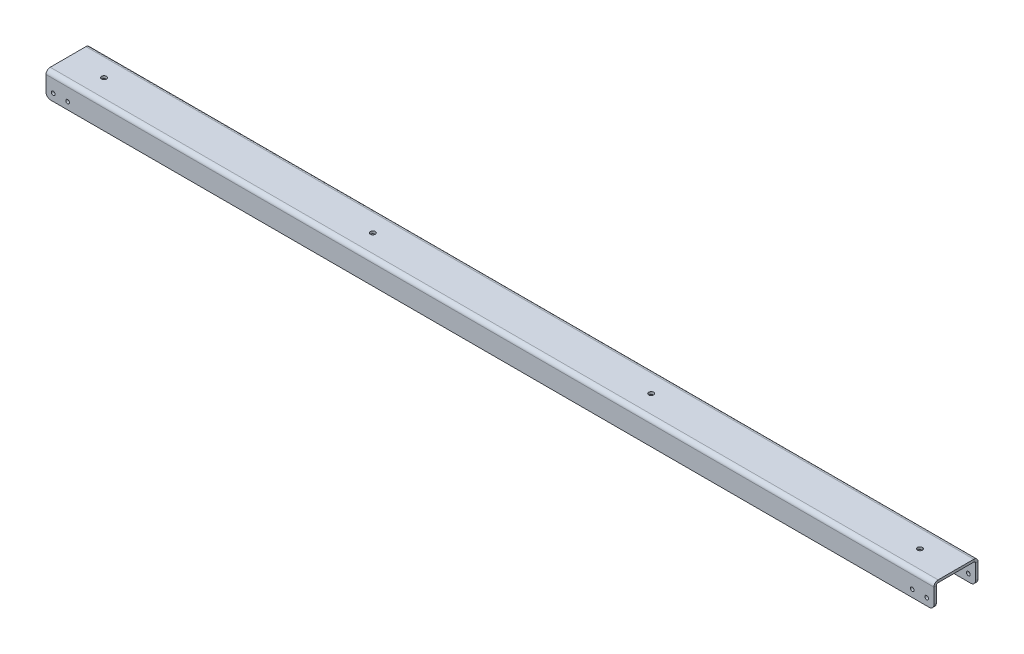
from build123d import *

# Parameters (mm, degrees)
SKETCH1_W                      = 1174.75
SKETCH1_H                      = 51.816
BASE_FLANGE1_DEPTH             = 3.2639
EDGE_FLANGE1_STRIP_W           = 17.6276
EDGE_FLANGE1_STRIP_H           = 3.2639
EDGE_FLANGE1_STRIP_CUT_DEPTH   = 1174.75
EDGE_FLANGE1_STRIP_2_W         = 17.6276
EDGE_FLANGE1_STRIP_2_H         = 3.2639
EDGE_FLANGE1_STRIP_CUT_2_DEPTH = 1174.75
EDGE_FLANGE1_DEPTH             = 1174.75
EDGE_FLANGE1_BEND_DEPTH        = 1174.75
F_10_0_1935_DIAMETER_HOLE2_D   = 4.9149
FILLET2_R                      = 6.35
F_1_4_CLEARANCE_HOLE1_D        = 6.5278


# Sheet-metal steps are written as plain solids
with BuildPart() as part:
    # Sketch1 → Base-Flange1 (new body)
    with BuildSketch(Plane(origin=(0, 0, 0), x_dir=(1, 0, 0), z_dir=(0, 1, 0))):
        Rectangle(SKETCH1_W, SKETCH1_H)
    extrude(amount=-BASE_FLANGE1_DEPTH)

    # Edge-Flange1 strip (across the edge) → Edge-Flange1 strip cut (cut)
    with BuildSketch(Plane(origin=(587.375, -3.2639, 25.908), x_dir=(0, 0, -1), z_dir=(-1, 0, 0))):
        with Locations((-6.5278, -1.63195)):
            Rectangle(EDGE_FLANGE1_STRIP_W, EDGE_FLANGE1_STRIP_H)
    extrude(amount=EDGE_FLANGE1_STRIP_CUT_DEPTH, mode=Mode.SUBTRACT)

    # Edge-Flange1 strip 2 (across the edge) → Edge-Flange1 strip cut 2 (cut)
    with BuildSketch(Plane(origin=(-587.375, -3.2639, -25.908), x_dir=(0, 0, 1), z_dir=(1, 0, 0))):
        with Locations((-6.5278, -1.63195)):
            Rectangle(EDGE_FLANGE1_STRIP_2_W, EDGE_FLANGE1_STRIP_2_H)
    extrude(amount=EDGE_FLANGE1_STRIP_CUT_2_DEPTH, mode=Mode.SUBTRACT)

    # Edge-Flange1 section (across the edge) → Edge-Flange1 (add)
    with BuildSketch(Plane(origin=(587.375, -3.2639, 25.908), x_dir=(0, 0, -1), z_dir=(-1, 0, 0))):
        with BuildLine():
            Line((-3.2639, 2.286), (-3.2639, 28.575))
            Line((-3.2639, 28.575), (0, 28.575))
            Line((0, 28.575), (0, 2.286))
            ThreePointArc((0, 2.286), (0.669553898, 0.669553898), (2.286, 0))
            Line((2.286, 0), (2.286, -3.2639))
            ThreePointArc((2.286, -3.2639), (-1.638371925, -1.638371925), (-3.2639, 2.286))
        make_face()
    extrude(amount=EDGE_FLANGE1_DEPTH)

    # Edge-Flange1 section 2 (across the edge) → Edge-Flange1 bend (add)
    with BuildSketch(Plane(origin=(-587.375, -3.2639, -25.908), x_dir=(0, 0, 1), z_dir=(1, 0, 0))):
        with BuildLine():
            Line((-3.2639, 2.286), (-3.2639, 28.575))
            Line((-3.2639, 28.575), (0, 28.575))
            Line((0, 28.575), (0, 2.286))
            ThreePointArc((0, 2.286), (0.669553898, 0.669553898), (2.286, 0))
            Line((2.286, 0), (2.286, -3.2639))
            ThreePointArc((2.286, -3.2639), (-1.638371925, -1.638371925), (-3.2639, 2.286))
        make_face()
    extrude(amount=EDGE_FLANGE1_BEND_DEPTH)

    # #10 (0.1935) Diameter Hole2 (through all)
    with Locations(Plane.XY.offset(29.1719)):
        with Locations((577.85, -22.3139), (558.8, -22.3139), (-558.8, -22.3139), (-577.85, -22.3139)):
            Hole(F_10_0_1935_DIAMETER_HOLE2_D / 2)

    # Fillet2
    fillet2_edges = [part.edges().sort_by_distance(p)[0] for p in [
        (587.375, -31.8389, 27.53995),
        (-587.375, -31.8389, 27.53995),
        (-587.375, -31.8389, -27.53995),
        (587.375, -31.8389, -27.53995),
    ]]
    fillet(fillet2_edges, radius=FILLET2_R)

    # 1/4 Clearance Hole1 (through all)
    with Locations(Plane(origin=(0, 0, 0), x_dir=(1, 0, 0), z_dir=(0, 1, 0))):
        with Locations((539.75, 0), (184.15, 0), (-184.15, 0), (-539.75, 0)):
            Hole(F_1_4_CLEARANCE_HOLE1_D / 2)


solid = part.part
